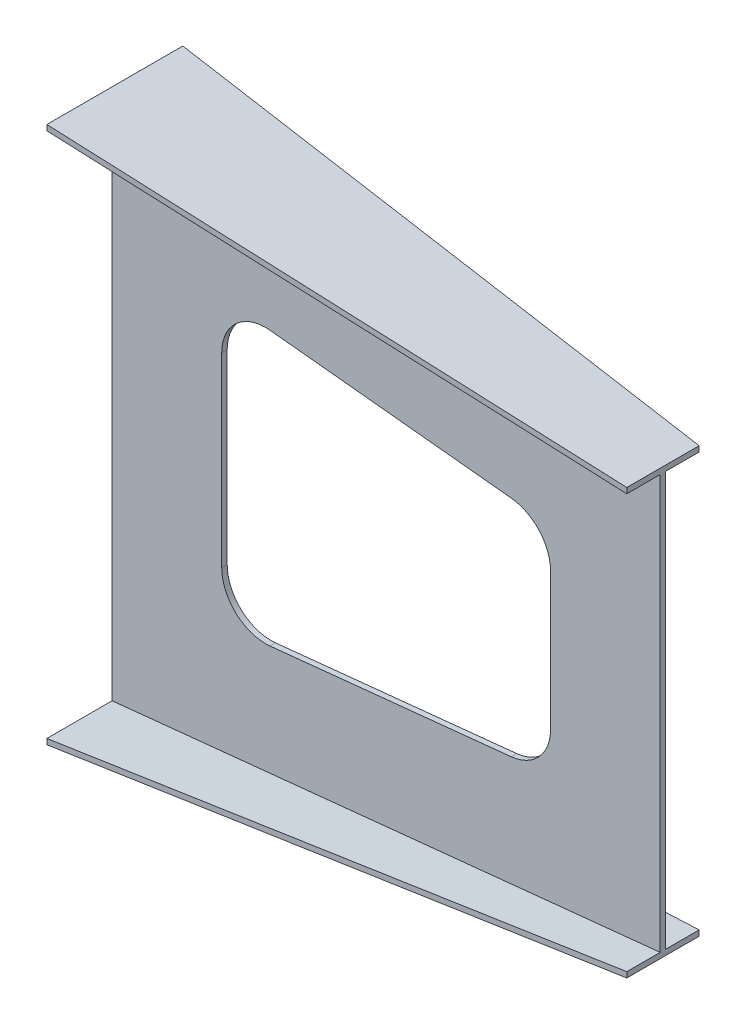
from build123d import *

# Parameters (mm, degrees)
CUT_EXTRUDE1_DEPTH = 1122.04460229


with BuildPart() as part:
    # Sketch1 → Loft l3 section 0
    with BuildSketch(Plane(origin=(0, 0, 0), x_dir=(0, 0, -1), z_dir=(1, 0, 0))):
        with BuildLine():
            Line((-129, 490), (119, 490))
            Line((119, 490), (119, 480))
            Line((119, 480), (0, 480))
            Line((0, 480), (0, -480))
            Line((0, -480), (119, -480))
            Line((119, -480), (119, -490))
            Line((119, -490), (-129, -490))
            Line((-129, -490), (-129, -480))
            Line((-129, -480), (-10, -480))
            Line((-10, -480), (-10, 480))
            Line((-10, 480), (-129, 480))
            Line((-129, 480), (-129, 490))
        make_face()
    # Sketch4 → Loft l3 section 1
    with BuildSketch(Plane(origin=(1000, 0, -1000), x_dir=(0, 0, 1), z_dir=(-1, 0, 0))):
        with BuildLine():
            Line((939, 387.5), (1071, 387.5))
            Line((1071, 387.5), (1071, 377.5))
            Line((1071, 377.5), (1010, 377.5))
            Line((1010, 377.5), (1010, -377.5))
            Line((1010, -377.5), (1071, -377.5))
            Line((1071, -377.5), (1071, -387.5))
            Line((1071, -387.5), (939, -387.5))
            Line((939, -387.5), (939, -377.5))
            Line((939, -377.5), (1000, -377.5))
            Line((1000, -377.5), (1000, 377.5))
            Line((1000, 377.5), (939, 377.5))
            Line((939, 377.5), (939, 387.5))
        make_face()
    loft()

    # Sketch6 → Cut-Extrude1 (cut, through all)
    with BuildSketch(Plane.XY.offset(10)):
        with BuildLine():
            Line((288.157260853, -249.416000893), (728.157260853, -204.316000893))
            ThreePointArc((728.157260853, -204.316000893), (779.382576856, -178.339959946), (800, -124.732968183))
            Line((800, -124.732968183), (800, 124.732968183))
            ThreePointArc((800, 124.732968183), (779.382576856, 178.339959946), (728.157260853, 204.316000893))
            Line((728.157260853, 204.316000893), (288.157260853, 249.416000893))
            ThreePointArc((288.157260853, 249.416000893), (226.393008237, 229.215545039), (200, 169.832968183))
            Line((200, 169.832968183), (200, -169.832968183))
            ThreePointArc((200, -169.832968183), (226.393008237, -229.215545039), (288.157260853, -249.416000893))
        make_face()
    extrude(amount=-CUT_EXTRUDE1_DEPTH, mode=Mode.SUBTRACT)


solid = part.part
